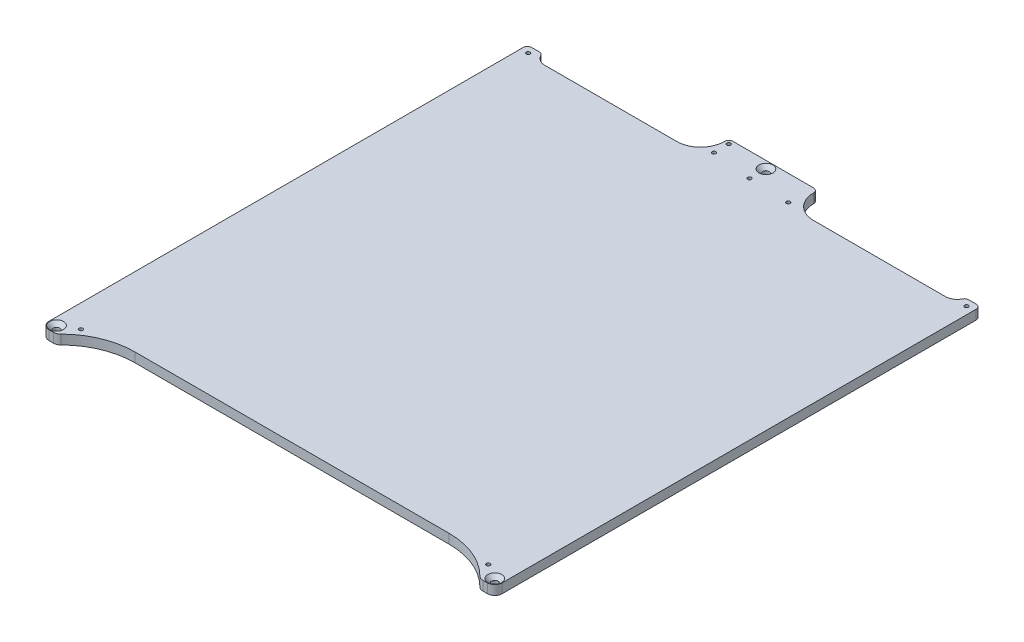
from build123d import *

# Parameters (mm, degrees)
BOSS_EXTRUDE1_DEPTH                             = 6.35
CSK_FOR_M4_FLAT_HEAD_MACHINE_SCREW1_D           = 4.3
CSK_FOR_M4_FLAT_HEAD_MACHINE_SCREW1_CSINK_D     = 9.4
CSK_FOR_M4_FLAT_HEAD_MACHINE_SCREW1_CSINK_ANGLE = 90
CHAMFER1_SIZE                                   = 16
SKETCH6_W                                       = 10
SKETCH6_H                                       = 6
BOSS_EXTRUDE2_DEPTH                             = 6.35
FILLET5_R                                       = 8
M3X0_5_TAPPED_HOLE1_D                           = 2.5
FILLET6_START                                   = -1
FILLET6_DEPTH                                   = 8
SKETCH18_W                                      = 25
SKETCH18_H                                      = 19
BOSS_EXTRUDE4_DEPTH                             = 6.35
FILLET12_R                                      = 3
M3X0_5_TAPPED_HOLE2_D                           = 2.5
FILLET13_R                                      = 50
FILLET14_R                                      = 16


with BuildPart() as part:
    # Sketch1 → Boss-Extrude1 (new body)
    with BuildSketch(Plane(origin=(0, 0, 0), x_dir=(1, 0, 0), z_dir=(0, 1, 0))):
        Polygon((-5, 171.5), (5, 171.5), (5, 152.5), (152.5, 152.5), (152.5, -168.5), (142.5, -168.5), (142.5, -152.5), (-142.5, -152.5), (-142.5, -168.5), (-152.5, -168.5), (-152.5, 152.5), (-5, 152.5), align=None)
    extrude(amount=BOSS_EXTRUDE1_DEPTH)

    # CSK for M4 Flat Head Machine Screw1 (through all)
    with Locations(Plane(origin=(0, 6.35, 0), x_dir=(1, 0, 0), z_dir=(0, 1, 0))):
        with Locations((0, 166.5), (-147.5, -163.5), (147.5, -163.5)):
            CounterSinkHole(CSK_FOR_M4_FLAT_HEAD_MACHINE_SCREW1_D / 2, CSK_FOR_M4_FLAT_HEAD_MACHINE_SCREW1_CSINK_D / 2, counter_sink_angle=CSK_FOR_M4_FLAT_HEAD_MACHINE_SCREW1_CSINK_ANGLE)

    # Chamfer1
    chamfer1_edges = [part.edges().sort_by_distance(p)[0] for p in [
        (142.5, 3.175, 152.5),
        (-142.5, 3.175, 152.5),
    ]]
    chamfer(chamfer1_edges, length=CHAMFER1_SIZE - 0.0001)  # a hair under: the kernel refuses the full size

    # Sketch6 → Boss-Extrude2 (add)
    with BuildSketch(Plane(origin=(0, 6.35, 0), x_dir=(1, 0, 0), z_dir=(0, 1, 0))):
        with Locations((-147.5, 155.5)):
            Rectangle(SKETCH6_W, SKETCH6_H)
        with Locations((147.5, 155.5)):
            Rectangle(SKETCH6_W, SKETCH6_H)
    extrude(amount=-BOSS_EXTRUDE2_DEPTH)

    # Fillet5
    # the kernel refuses this fillet: 8 mm, written as the material it adds along each edge
    with BuildSketch(Plane(origin=(142.5, 6.35, -152.5), x_dir=(0, 0, -1), z_dir=(0, -1, 0))) as fillet5_piece_1:
        with BuildLine():
            CenterArc((8, -7.745966692), FILLET5_R, 104.477512186, 75.522487814)
            Line((0, -7.745966692), (-0.16, -7.745966692))
            Line((-0.16, -7.745966692), (-0.16, 0))
            Line((-0.16, 0), (0, 0.16))
            ThreePointArc((0, 0.16), (3, 0.16), (5.96, 0.154919334))
            Line((5.96, 0.154919334), (6, 0))
        make_face()
    extrude(amount=6.35)
    with BuildSketch(Plane(origin=(-142.5, 6.35, -152.5), x_dir=(1, 0, 0), z_dir=(0, -1, 0))) as fillet5_piece_2:
        with BuildLine():
            CenterArc((7.745966692, -8), FILLET5_R, 90, 75.522487814)
            Line((0, -6), (-0.154919334, -5.96))
            ThreePointArc((-0.154919334, -5.96), (-0.16, -3), (-0.16, 0))
            Line((-0.16, 0), (0, 0.16))
            Line((0, 0.16), (7.745966692, 0.16))
            Line((7.745966692, 0.16), (7.745966692, 0))
        make_face()
    extrude(amount=6.35)

    # M3x0.5 Tapped Hole1 (through all)
    with Locations(Plane(origin=(0, 6.35, 0), x_dir=(1, 0, 0), z_dir=(0, 1, 0))):
        with Locations((-147.5, 154), (147.5, 154), (137.107695155, -157.5), (-137.107695155, -157.5), (0, 155.5)):
            Hole(M3X0_5_TAPPED_HOLE1_D / 2)

    # Fillet6: read off the stored shape, not the designer's step
    # Fillet6 outline → Fillet6 (cut)
    with BuildSketch(Plane(origin=(0, 0, 0), x_dir=(1, 0, 0), z_dir=(0, 1, 0)).offset(FILLET6_START)):
        with BuildLine():
            ThreePointArc((152.5, -163.5), (151.035533906, -167.035533906), (147.5, -168.5))
            Line((147.5, -168.5), (152.5, -168.5))
            Line((152.5, -168.5), (152.5, -163.5))
        make_face()
        with BuildLine():
            ThreePointArc((144.571067812, -168.5), (142.65765065, -168.119397663), (141.035533906, -167.035533906))
            Line((141.035533906, -167.035533906), (142.5, -168.5))
            Line((142.5, -168.5), (144.571067812, -168.5))
        make_face()
        with BuildLine():
            ThreePointArc((-141.035533906, -167.035533906), (-142.65765065, -168.119397663), (-144.571067812, -168.5))
            Line((-144.571067812, -168.5), (-142.5, -168.5))
            Line((-142.5, -168.5), (-141.035533906, -167.035533906))
        make_face()
        with BuildLine():
            Line((-152.5, -168.5), (-147.5, -168.5))
            ThreePointArc((-147.5, -168.5), (-151.035533906, -167.035533906), (-152.5, -163.5))
            Line((-152.5, -163.5), (-152.5, -168.5))
        make_face()
    extrude(amount=FILLET6_DEPTH, mode=Mode.SUBTRACT)

    # Sketch18 → Boss-Extrude4 (add)
    with BuildSketch(Plane.XZ):
        with Locations((17.5, -162)):
            Rectangle(SKETCH18_W, SKETCH18_H)
        with Locations((-17.5, -162)):
            Rectangle(SKETCH18_W, SKETCH18_H)
    extrude(amount=-BOSS_EXTRUDE4_DEPTH)

    # Fillet12
    fillet12_edges = [part.edges().sort_by_distance(p)[0] for p in [
        (30, 3.175, -171.5),
        (-30, 3.175, -171.5),
        (-142.5, 3.175, -158.5),
        (-152.5, 3.175, -158.5),
        (142.5, 3.175, -158.5),
        (152.5, 3.175, -158.5),
    ]]
    fillet(fillet12_edges, radius=FILLET12_R)

    # M3x0.5 Tapped Hole2 (through all)
    with Locations(Plane(origin=(0, 6.35, 0), x_dir=(1, 0, 0), z_dir=(0, 1, 0))):
        with Locations((27, 154.5), (-27, 168.5), (-27, 158.5)):
            Hole(M3X0_5_TAPPED_HOLE2_D / 2)

    # Fillet13
    # the kernel refuses this fillet: 50 mm, written as the material it adds along each edge
    with BuildSketch(Plane(origin=(126.5001, 0, 152.5), x_dir=(-1, 0, 0), z_dir=(0, 1, 0))) as fillet13_piece_1:
        with BuildLine():
            CenterArc((20.710446515, 50), FILLET13_R, 225.146645298, 44.853354702)
            Line((-14.554286856, 14.554286856), (-15.259581524, 13.845372594))
            Line((-15.259581524, 13.845372594), (-0.707106781, -0.707106781))
            Line((-0.707106781, -0.707106781), (0, -1))
            Line((0, -1), (20.710446515, -1))
            Line((20.710446515, -1), (20.710446515, 0))
        make_face()
    extrude(amount=6.35)
    with BuildSketch(Plane(origin=(-126.5001, 0, 152.5), x_dir=(-0.7071067811865476, 0, 0.7071067811865476), z_dir=(0, 1, 0))) as fillet13_piece_2:
        with BuildLine():
            CenterArc((20.710841887, 49.999836231), FILLET13_R, 225, 44.853354702)
            Line((-14.644497172, 14.644497172), (-15.351603953, 13.937390391))
            Line((-15.351603953, 13.937390391), (-0.707106781, -0.707106781))
            Line((-0.707106781, -0.707106781), (0, -1))
            Line((0, -1), (20.580310423, -0.999996725))
            Line((20.580310423, -0.999996725), (20.582869863, 0))
        make_face()
    extrude(amount=6.35)

    # Fillet14
    fillet14_edges = [part.edges().sort_by_distance(p)[0] for p in [
        (30, 3.175, -152.5),
        (-30, 3.175, -152.5),
    ]]
    fillet(fillet14_edges, radius=FILLET14_R - 0.0001)  # a hair under: the kernel refuses the full size


solid = part.part
